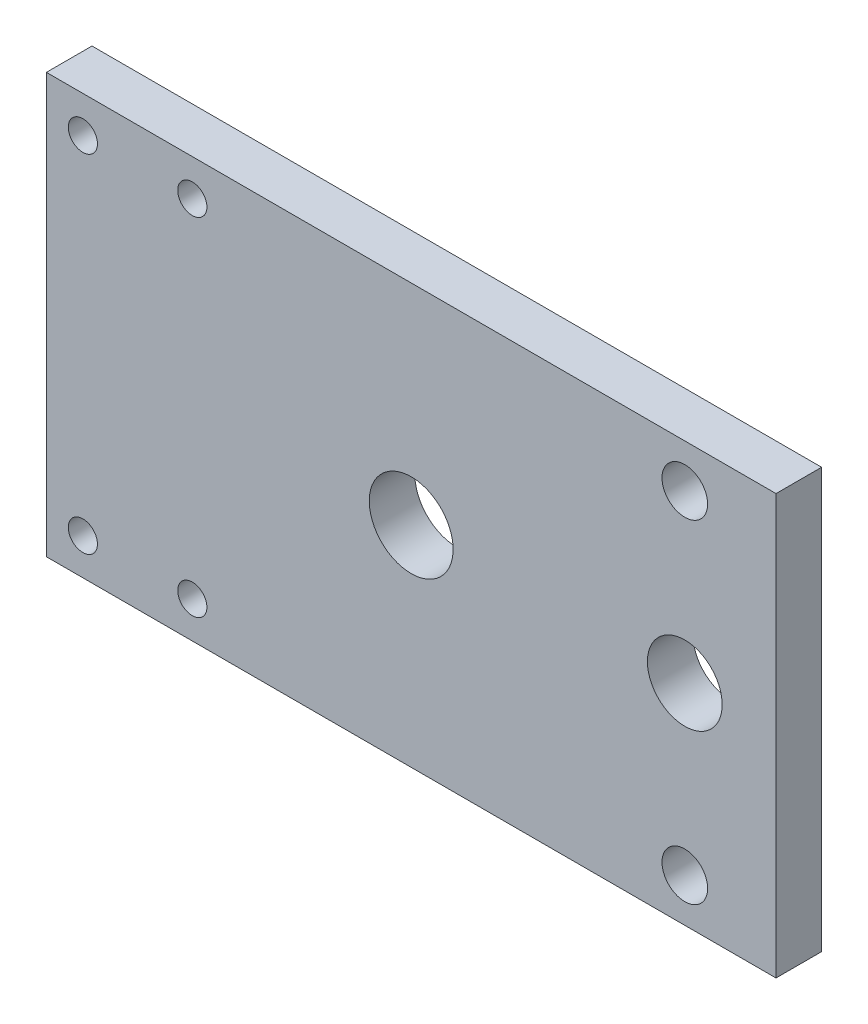
from build123d import *

# Parameters (mm, degrees)
SKETCH1_W           = 80
SKETCH1_H           = 46
SKETCH1_R           = 4.6
SKETCH1_R_2         = 2.5
BOSS_EXTRUDE1_DEPTH = 5
SKETCH2_R           = 1.6
CUT_EXTRUDE1_DEPTH  = 10


with BuildPart() as part:
    # Sketch1 → Boss-Extrude1 (new body)
    with BuildSketch(Plane.XY):
        Rectangle(SKETCH1_W, SKETCH1_H)
        Circle(SKETCH1_R, mode=Mode.SUBTRACT)
        with Locations((30, -18.25)):
            Circle(SKETCH1_R_2, mode=Mode.SUBTRACT)
        with BuildLine():
            ThreePointArc((34.1, 0), (27.100862197, -2.899137803), (30, 4.1))
            ThreePointArc((30, 4.1), (32.899137803, 2.899137803), (34.1, 0))
        make_face(mode=Mode.SUBTRACT)
        with BuildLine():
            ThreePointArc((32.5, 18.25), (31.767766953, 16.482233047), (30, 15.75))
            ThreePointArc((30, 15.75), (28.232233047, 20.017766953), (32.5, 18.25))
        make_face(mode=Mode.SUBTRACT)
    extrude(amount=BOSS_EXTRUDE1_DEPTH)

    # Sketch2 → Cut-Extrude1 (cut)
    with BuildSketch(Plane.XY.offset(5)):
        with Locations((-36, -19)):
            Circle(SKETCH2_R)
        with Locations((-36, 19)):
            Circle(SKETCH2_R)
        with Locations((-24, -19)):
            Circle(SKETCH2_R)
        with Locations((-24, 19)):
            Circle(SKETCH2_R)
    extrude(amount=-CUT_EXTRUDE1_DEPTH, mode=Mode.SUBTRACT)


solid = part.part
